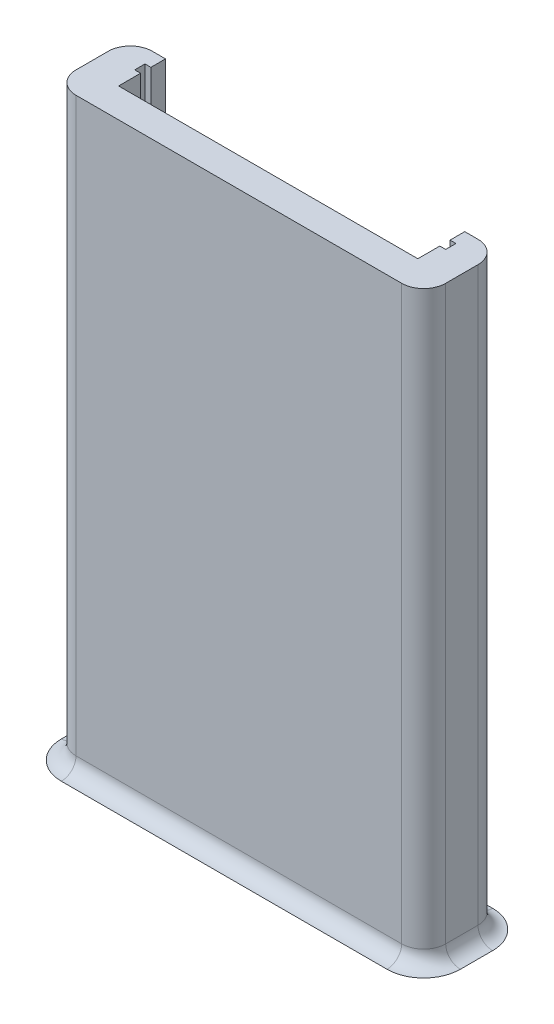
from build123d import *

# Parameters (mm, degrees)
SKETCH2_W               = 88.9
SKETCH2_H               = 152.4
BOSS_EXTRUDE1_DEPTH     = 5.9944
CUT_EXTRUDE2_DEPTH      = 177.535840076
CUT_EXTRUDE2_DEPTH_BACK = 177.535840076
SKETCH4_R               = 2.7305
BOSS_EXTRUDE2_DEPTH     = 101.6
FILLET1_R               = 3.81
FILLET2_R               = 2.54
BOSS_EXTRUDE3_DEPTH     = 20.32
FILLET3_R               = 3.81
FILLET6_R               = 3.81
FILLET7_R               = 2.54
CUT_EXTRUDE3_DEPTH      = 204.596488182
CUT_EXTRUDE3_DEPTH_BACK = 204.596488182
SKETCH7_W               = 2.54
SKETCH7_H               = 152.4
SKETCH8_W               = 86.36
SKETCH8_H               = 152.4
CUT_EXTRUDE5_DEPTH      = 5.9944
SKETCH9_R               = 0.79375
CUT_EXTRUDE6_DEPTH      = 3.175


with BuildPart() as part:
    # Sketch2 → Boss-Extrude1 (new body)
    with BuildSketch(Plane(origin=(0, 0, 0), x_dir=(1, 0, 0), z_dir=(0, 1, 0))):
        with Locations((44.45, 76.2)):
            Rectangle(SKETCH2_W, SKETCH2_H)
    extrude(amount=BOSS_EXTRUDE1_DEPTH)

    # Sketch4 → Cut-Extrude2 (cut, two sides: drawn at the far end of the back side and taken through both)
    with BuildSketch(Plane(origin=(0, 5.9944, 0), x_dir=(1, 0, 0), z_dir=(0, 1, 0)).offset(-CUT_EXTRUDE2_DEPTH_BACK)):
        with Locations(Location((45.72, 109.871331367, 0), (0, 0, 270))):
            Circle(SKETCH4_R)
        with Locations(Location((45.72, 33.671331367, 0), (0, 0, 270))):
            Circle(SKETCH4_R)
    extrude(amount=CUT_EXTRUDE2_DEPTH + CUT_EXTRUDE2_DEPTH_BACK, mode=Mode.SUBTRACT)

    # Sketch5 → Boss-Extrude2 (add)
    with BuildSketch(Plane(origin=(0, 5.9944, 0), x_dir=(1, 0, 0), z_dir=(0, 1, 0))):
        Polygon((18.542, 15.748), (12.446, 15.748), (12.446, 2.54), (76.454, 2.54), (76.454, 15.748), (70.358, 15.748), (70.358, 13.208), (71.374, 13.208), (71.374, 11.43), (70.358, 11.43), (70.358, 7.62), (18.542, 7.62), (18.542, 11.43), (17.526, 11.43), (17.526, 13.208), (18.542, 13.208), align=None)
    extrude(amount=BOSS_EXTRUDE2_DEPTH)

    # Fillet1
    fillet1_edges = [part.edges().sort_by_distance(p)[0] for p in [
        (12.446, 56.7944, -15.748),
        (12.446, 56.7944, -2.54),
        (76.454, 56.7944, -2.54),
        (76.454, 56.7944, -15.748),
    ]]
    fillet(fillet1_edges, radius=FILLET1_R)

    # Fillet2
    fillet2_edges = [part.edges().sort_by_distance(p)[0] for p in [
        (71.501, 5.9944, -15.748),
        (44.45, 5.9944, -2.54),
        (12.446, 5.9944, -9.144),
        (17.399, 5.9944, -15.748),
        (76.454, 5.9944, -9.144),
        (13.561923164, 5.9944, -3.655923164),
        (13.561923164, 5.9944, -14.632076836),
        (75.338076836, 5.9944, -3.655923164),
        (75.338076836, 5.9944, -14.632076836),
    ]]
    fillet(fillet2_edges, radius=FILLET2_R - 0.0001)  # a hair under: the kernel refuses the full size

    # Sketch6 → Boss-Extrude3 (add, symmetric)
    with BuildSketch(Plane.ZY.offset(-44.45)):
        Polygon((-149.86, 5.9944), (-79.121, 5.9944), (-79.121, 23.1394), (-86.106, 23.1394), (-86.106, 18.0594), (-84.201, 18.0594), (-84.201, 16.1544), (-86.106, 16.1544), (-86.106, 11.0744), (-142.875, 11.0744), (-142.875, 16.1544), (-144.78, 16.1544), (-144.78, 18.0594), (-142.875, 18.0594), (-142.875, 23.1394), (-149.86, 23.1394), align=None)
    extrude(amount=BOSS_EXTRUDE3_DEPTH, both=True)

    # Fillet3
    fillet3_edges = [part.edges().sort_by_distance(p)[0] for p in [
        (44.45, 23.1394, -149.86),
        (44.45, 23.1394, -79.121),
    ]]
    fillet(fillet3_edges, radius=FILLET3_R)

    # Fillet6
    fillet6_edges = [part.edges().sort_by_distance(p)[0] for p in [
        (24.13, 12.6619, -149.86),
        (64.77, 12.6619, -79.121),
        (24.13, 23.1394, -84.5185),
        (24.13, 12.6619, -79.121),
        (64.77, 23.1394, -84.5185),
        (64.77, 12.6619, -149.86),
        (64.77, 23.1394, -144.4625),
        (64.77, 22.023476836, -148.744076836),
        (64.77, 22.023476836, -80.236923164),
        (24.13, 23.1394, -144.4625),
        (24.13, 22.023476836, -148.744076836),
        (24.13, 22.023476836, -80.236923164),
    ]]
    fillet(fillet6_edges, radius=FILLET6_R)

    # Fillet7
    fillet7_edges = [part.edges().sort_by_distance(p)[0] for p in [
        (24.13, 5.9944, -114.4905),
        (64.77, 5.9944, -114.4905),
        (44.45, 5.9944, -79.121),
        (44.45, 5.9944, -149.86),
        (25.245923164, 5.9944, -80.236923164),
        (63.654076836, 5.9944, -80.236923164),
        (63.654076836, 5.9944, -148.744076836),
        (25.245923164, 5.9944, -148.744076836),
    ]]
    fillet(fillet7_edges, radius=FILLET7_R - 0.0001)  # a hair under: the kernel refuses the full size

    # Sketch7 → Cut-Extrude3 (cut, two sides: drawn at the far end of the back side and taken through both)
    with BuildSketch(Plane(origin=(0, 5.9944, 0), x_dir=(1, 0, 0), z_dir=(0, 1, 0)).offset(-CUT_EXTRUDE3_DEPTH_BACK)):
        with Locations((1.27, 76.2)):
            Rectangle(SKETCH7_W, SKETCH7_H)
    extrude(amount=CUT_EXTRUDE3_DEPTH + CUT_EXTRUDE3_DEPTH_BACK, mode=Mode.SUBTRACT)

    # Sketch8 → Cut-Extrude5 (cut)
    with BuildSketch(Plane.XZ):
        with Locations((45.72, -76.2)):
            Rectangle(SKETCH8_W, SKETCH8_H)
    extrude(amount=-CUT_EXTRUDE5_DEPTH, mode=Mode.SUBTRACT)


with BuildPart() as body_2:
    # of the pieces the cut leaves, the one that is kept (cut_extrude5_keep)
    add(part.part.solids().sort_by_distance((18.542, 8.5343, -15.748))[0])

    # Sketch9 → Cut-Extrude6 (cut)
    with BuildSketch(Plane.XZ.offset(-5.9944)):
        with Locations(Location((69.85, -5.08, 0), (0, 0, 270))):
            Circle(SKETCH9_R)
        with Locations(Location((19.05, -5.08, 0), (0, 0, 270))):
            Circle(SKETCH9_R)
    extrude(amount=-CUT_EXTRUDE6_DEPTH, mode=Mode.SUBTRACT)


solid = body_2.part
